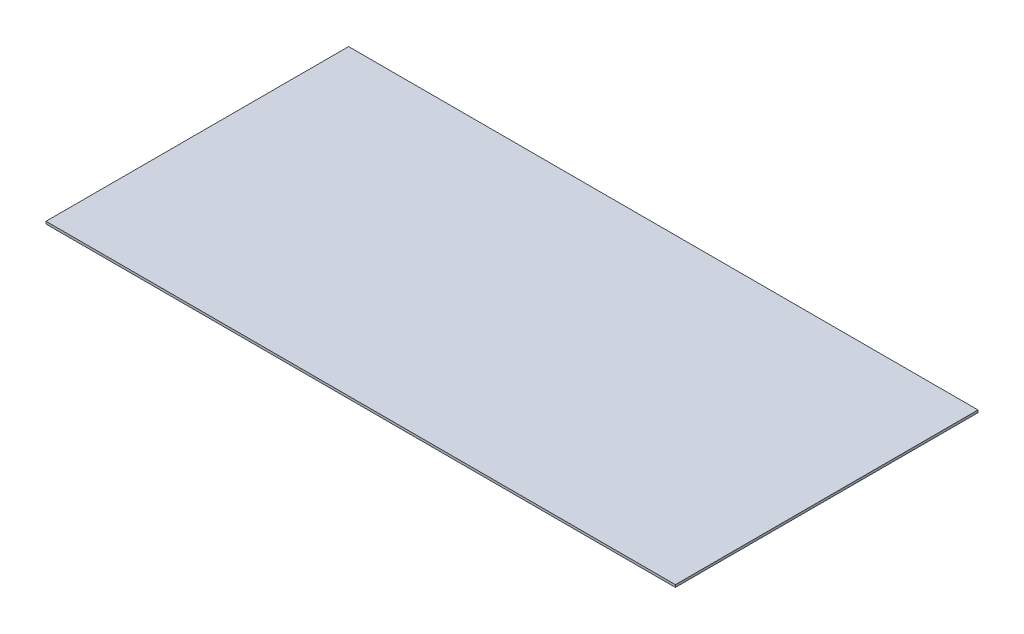
from build123d import *

# Parameters (mm, degrees)
SKETCH2_W      = 2600
SKETCH2_H      = 1250
EXTRUDE1_DEPTH = 10


with BuildPart() as part:
    # Sketch2 → Extrude1 (new body)
    with BuildSketch(Plane(origin=(0, 0, 0), x_dir=(1, 0, 0), z_dir=(0, 1, 0))):
        with Locations((1300, 625)):
            Rectangle(SKETCH2_W, SKETCH2_H)
    extrude(amount=EXTRUDE1_DEPTH)


solid = part.part
